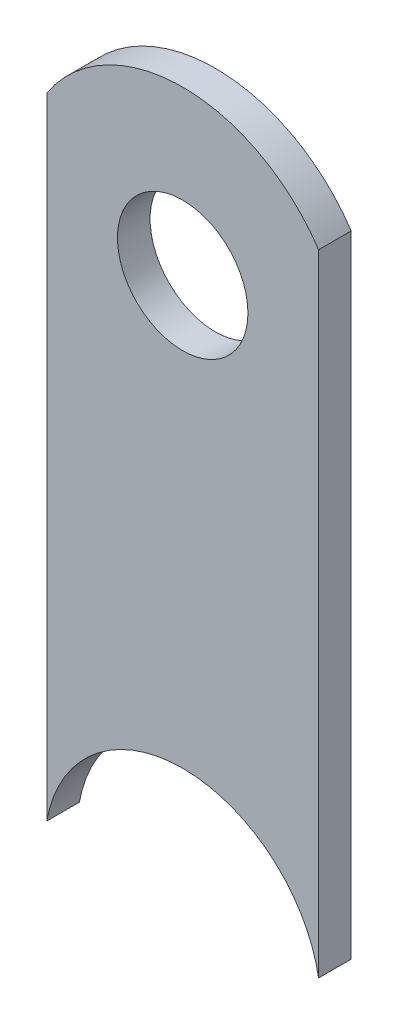
from build123d import *

# Parameters (mm, degrees)
SKETCH1_R          = 6
BASE_FLANGE1_DEPTH = 3


# Sheet-metal steps are written as plain solids
with BuildPart() as part:
    # Sketch1 → Base-Flange1 (new body)
    with BuildSketch(Plane.XY):
        with BuildLine():
            Line((-12.5, 29), (-12.5, -29))
            ThreePointArc((-12.5, -29), (0, -18.544994432), (12.5, -29))
            Line((12.5, -29), (12.5, 29))
            ThreePointArc((12.5, 29), (0, 35.708438024), (-12.5, 29))
        make_face()
        with Locations((0, 20.708438024)):
            Circle(SKETCH1_R, mode=Mode.SUBTRACT)
    extrude(amount=-BASE_FLANGE1_DEPTH)


solid = part.part
